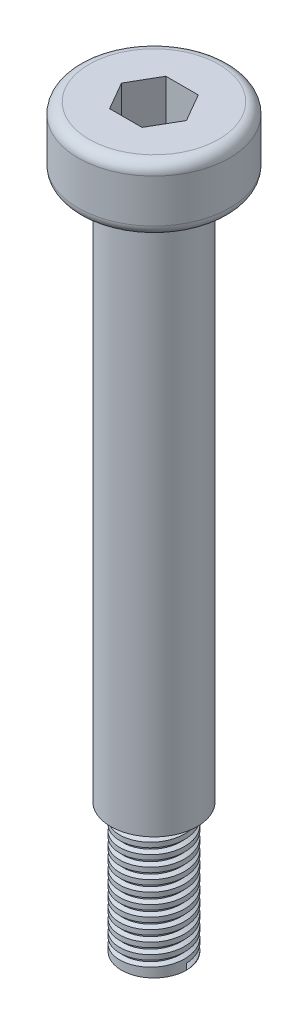
from build123d import *
from build123d.topology import SkipClean

# Parameters (mm, degrees)
SKETCH8_R           = 1.5
BOSS_EXTRUDE4_DEPTH = 6
SKETCH9_R           = 2
BOSS_EXTRUDE5_DEPTH = 25
SKETCH10_R          = 3.5
BOSS_EXTRUDE6_DEPTH = 3
CUT_EXTRUDE3_DEPTH  = 2
FILLET2_R           = 0.5
THREAD2_PITCH       = 0.5


with BuildPart() as part:
    # Sketch8 → Boss-Extrude4 (new body)
    with BuildSketch(Plane(origin=(0, 0, 0), x_dir=(1, 0, 0), z_dir=(0, 1, 0))):
        with Locations(Location((0, 0, 0), (0, 0, 270))):
            Circle(SKETCH8_R)
    extrude(amount=BOSS_EXTRUDE4_DEPTH)

    # Sketch9 → Boss-Extrude5 (add)
    with BuildSketch(Plane(origin=(0, 6, 0), x_dir=(1, 0, 0), z_dir=(0, 1, 0))):
        with Locations(Location((0, 0, 0), (0, 0, 270))):
            Circle(SKETCH9_R)
    extrude(amount=BOSS_EXTRUDE5_DEPTH)

    # Sketch10 → Boss-Extrude6 (add)
    with BuildSketch(Plane(origin=(0, 31, 0), x_dir=(1, 0, 0), z_dir=(0, 1, 0))):
        with Locations(Location((0, 0, 0), (0, 0, 270))):
            Circle(SKETCH10_R)
    extrude(amount=BOSS_EXTRUDE6_DEPTH)

    # Sketch11 → Cut-Extrude3 (cut)
    with BuildSketch(Plane(origin=(0, 34, 0), x_dir=(1, 0, 0), z_dir=(0, 1, 0))):
        Polygon((1.5, 0), (0.75, 1.299038106), (-0.75, 1.299038106), (-1.5, 0), (-0.75, -1.299038106), (0.75, -1.299038106), align=None)
    extrude(amount=-CUT_EXTRUDE3_DEPTH, mode=Mode.SUBTRACT)

    # Fillet2
    fillet2_edges = [part.edges().sort_by_distance(p)[0] for p in [
        (0, 31, -3.5),
        (0, 34, -3.5),
    ]]
    fillet(fillet2_edges, radius=FILLET2_R)

    # Thread2: the profile of Thread Profile2 profile screwed along a right-hand helix of 12 turns, 6 arcs to a turn; built about Z, then put on its axis
    with SkipClean():  # the faces are left unmerged after this step: merging them gives an invalid solid
        thread2_z = Axis((0, 0, 0), (0, 0, 1))
        thread2_corners = [(1.5003, 0, -0.000173205), (1.5003, 0, 0.277985704), (1.328148085, 0, 0.17859375), (1.328148085, 0, 0.09921875)]
        with BuildLine(mode=Mode.PRIVATE) as thread2_profile:
            Line(thread2_corners[0], thread2_corners[1])
            Line(thread2_corners[1], thread2_corners[2])
            Line(thread2_corners[2], thread2_corners[3])
            Line(thread2_corners[3], thread2_corners[0])
        thread2_cap = Face(thread2_profile.wire())
        thread2_turn_angles = [0, 30, 60, 90, 120, 150, 180, 210, 240, 270, 300, 330, 360]
        thread2_turn_weights = [1, 0.8660254037844387, 1, 0.8660254037844387, 1, 0.8660254037844387, 1, 0.8660254037844387, 1, 0.8660254037844387, 1, 0.8660254037844387, 1]
        thread2_turn_rails = [Edge.make_bspline([Vector(p[0], p[1], 0).rotate(thread2_z, thread2_turn_angles[k]) / thread2_turn_weights[k] + Vector(0, 0, p[2] + THREAD2_PITCH * thread2_turn_angles[k] / 360) for k in range(13)], [0, 0, 0, 1, 1, 2, 2, 3, 3, 4, 4, 5, 5, 6, 6, 6], 2, thread2_turn_weights) for p in thread2_corners]
        thread2_turn_sides = [Face.make_surface_from_curves(thread2_turn_rails[p[0]], thread2_turn_rails[p[1]]) for p in [(0, 1), (1, 2), (2, 3), (3, 0)]]
        thread2 = Plane(origin=(0, 0, 0), x_dir=(1, 0, 0), z_dir=(0, 1, 0)) * Solid(Shell([*[p.moved(Location((0, 0, THREAD2_PITCH * i))) for i in range(12) for p in thread2_turn_sides], thread2_cap, thread2_cap.rotate(thread2_z, 4320).moved(Location((0, 0, THREAD2_PITCH * 4320 / 360)))]))
        add(thread2, mode=Mode.SUBTRACT)


solid = part.part
